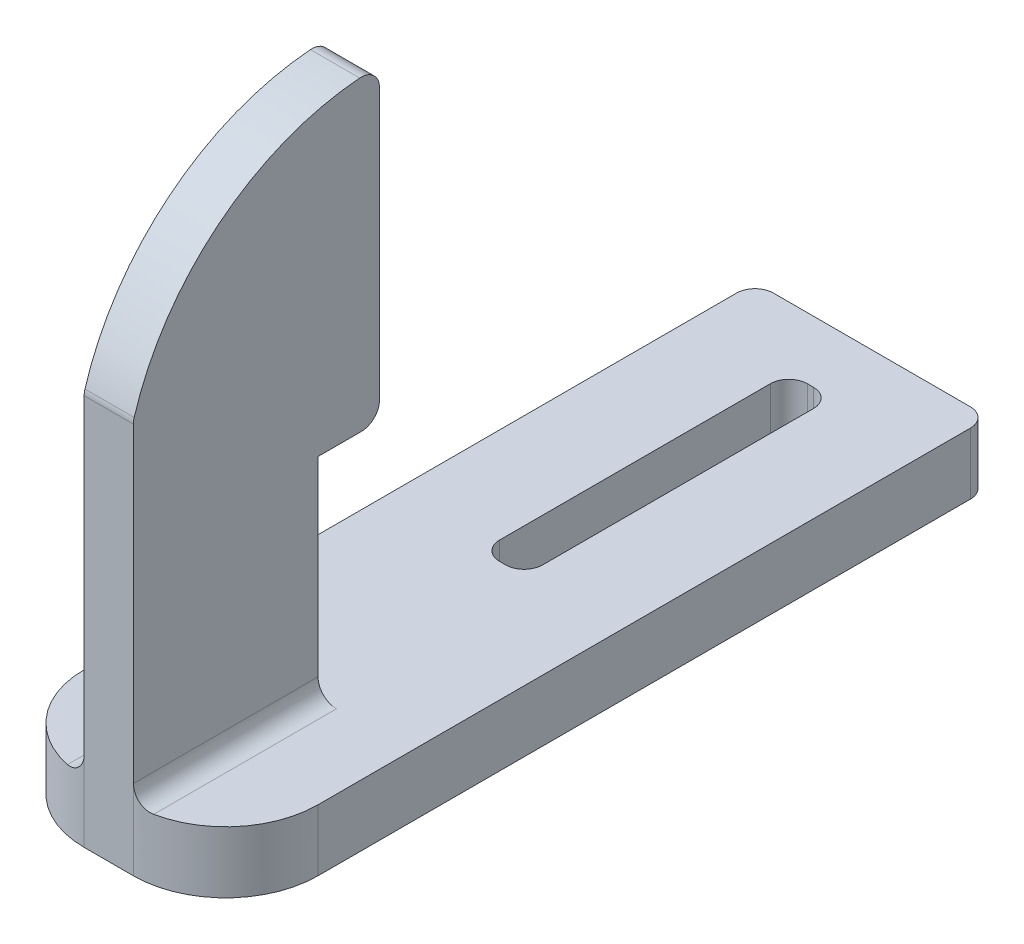
from build123d import *

# Parameters (mm, degrees)
SKETCH1_W           = 19
SKETCH1_H           = 62
SKETCH1_W_2         = 3.5
SKETCH1_H_2         = 25
BOSS_EXTRUDE1_DEPTH = 5
SKETCH4_W           = 4
SKETCH4_H           = 15
BOSS_EXTRUDE3_DEPTH = 17
BOSS_EXTRUDE4_DEPTH = 4
CUT_EXTRUDE1_DEPTH  = 78.259303647
FILLET1_R           = 1.5


with BuildPart() as part:
    # Sketch1 → Boss-Extrude1 (new body)
    with BuildSketch(Plane(origin=(0, 0, 0), x_dir=(1, 0, 0), z_dir=(0, 1, 0))):
        with Locations((-9.5, 31)):
            Rectangle(SKETCH1_W, SKETCH1_H)
        with Locations((-9.5, 44.5)):
            Rectangle(SKETCH1_W_2, SKETCH1_H_2, mode=Mode.SUBTRACT)
    extrude(amount=BOSS_EXTRUDE1_DEPTH)

    # Sketch4 → Boss-Extrude3 (add)
    with BuildSketch(Plane(origin=(0, 5, 0), x_dir=(1, 0, 0), z_dir=(0, 1, 0))):
        with Locations((-9.5, 7.5)):
            Rectangle(SKETCH4_W, SKETCH4_H)
    extrude(amount=BOSS_EXTRUDE3_DEPTH)

    # Sketch5 → Boss-Extrude4 (add)
    with BuildSketch(Plane(origin=(-7.5, 0, 0), x_dir=(0, 0, -1), z_dir=(1, 0, 0))):
        with BuildLine():
            Line((15, 22), (20, 22))
            Line((20, 22), (20, 47))
            ThreePointArc((20, 47), (7.5, 42.833333333), (0, 32))
            Line((0, 32), (0, 22))
            Line((0, 22), (15, 22))
        make_face()
    extrude(amount=-BOSS_EXTRUDE4_DEPTH)

    # Sketch6 → Cut-Extrude1 (cut, through all)
    with BuildSketch(Plane(origin=(0, 5, 0), x_dir=(1, 0, 0), z_dir=(0, 1, 0))):
        with BuildLine():
            Line((-19, 7.5), (-19, 0))
            Line((-19, 0), (-11.5, 0))
            ThreePointArc((-11.5, 0), (-16.803300859, 2.196699141), (-19, 7.5))
        make_face()
        with BuildLine():
            Line((0, 0), (-7.5, 0))
            ThreePointArc((-7.5, 0), (-2.196699141, 2.196699141), (0, 7.5))
            Line((0, 7.5), (0, 0))
        make_face()
    extrude(amount=-CUT_EXTRUDE1_DEPTH, mode=Mode.SUBTRACT)

    # Fillet1
    fillet1_edges = [part.edges().sort_by_distance(p)[0] for p in [
        (-9.5, 22, -20),
        (-11.25, 2.5, -57),
        (-7.75, 2.5, -57),
        (-7.75, 2.5, -32),
        (-11.25, 2.5, -32),
        (-19, 2.5, -62),
        (0, 2.5, -62),
        (-11.5, 5, -7.5),
        (-7.5, 5, -7.5),
        (-9.5, 47, -20),
        (-9.5, 32, 0),
    ]]
    fillet(fillet1_edges, radius=FILLET1_R)


solid = part.part
